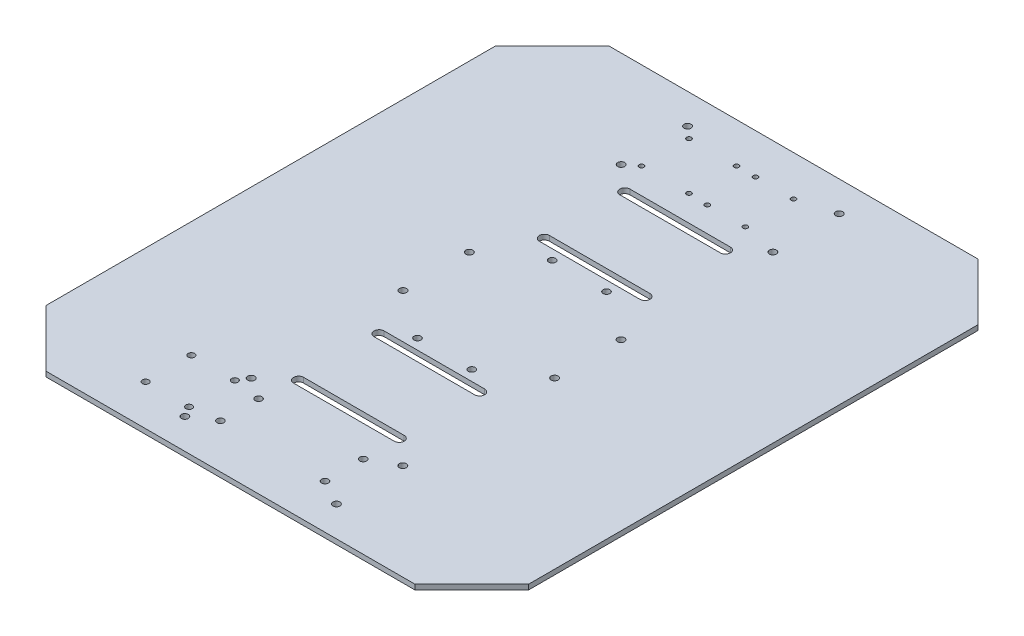
from build123d import *

# Parameters (mm, degrees)
SKETCH1_R               = 2.2225
BOSS_EXTRUDE1_DEPTH     = 3.175
SKETCH2_R               = 2.159
CUT_EXTRUDE1_DEPTH      = 297.247830215
CUT_EXTRUDE2_DEPTH      = 297.247830215
SKETCH7_R               = 1.524
CUT_EXTRUDE3_DEPTH      = 297.247830215
CUT_EXTRUDE4_DEPTH      = 297.247830215
CUT_EXTRUDE4_DEPTH_BACK = 297.247830215
SKETCH8_R               = 1.524
SKETCH9_R               = 2.032
CUT_EXTRUDE5_DEPTH      = 297.247830215
SKETCH10_R              = 2.159
CUT_EXTRUDE6_DEPTH      = 297.247830215


with BuildPart() as part:
    # Sketch1 → Boss-Extrude1 (new body)
    with BuildSketch(Plane(origin=(0, 0, 0), x_dir=(1, 0, 0), z_dir=(0, 1, 0))):
        Polygon((-85.365028143, 123.058976948), (-121.286052627, 87.137952464), (-121.286052627, -196.619998567), (-85.365028143, -232.541023052), (147.592922888, -232.541023052), (183.513947373, -196.619998567), (183.513947373, 87.137952464), (147.592922888, 123.058976948), align=None)
        with Locations((-16.765052627, -213.491023052)):
            Circle(SKETCH1_R, mode=Mode.SUBTRACT)
        with Locations((-16.765052627, -171.581023052)):
            Circle(SKETCH1_R, mode=Mode.SUBTRACT)
        with Locations((-16.765052627, -75.696023052)):
            Circle(SKETCH1_R, mode=Mode.SUBTRACT)
        with Locations((78.992947373, -213.491023052)):
            Circle(SKETCH1_R, mode=Mode.SUBTRACT)
        with Locations((78.992947373, -171.581023052)):
            Circle(SKETCH1_R, mode=Mode.SUBTRACT)
        with Locations((78.992947373, -75.696023052)):
            Circle(SKETCH1_R, mode=Mode.SUBTRACT)
        with Locations((-16.765052627, -33.786023052)):
            Circle(SKETCH1_R, mode=Mode.SUBTRACT)
        with Locations((-16.765052627, 62.098976948)):
            Circle(SKETCH1_R, mode=Mode.SUBTRACT)
        with Locations((-16.765052627, 104.008976948)):
            Circle(SKETCH1_R, mode=Mode.SUBTRACT)
        with Locations((78.992947373, -33.786023052)):
            Circle(SKETCH1_R, mode=Mode.SUBTRACT)
        with Locations((78.992947373, 62.098976948)):
            Circle(SKETCH1_R, mode=Mode.SUBTRACT)
        with Locations((78.992947373, 104.008976948)):
            Circle(SKETCH1_R, mode=Mode.SUBTRACT)
    extrude(amount=BOSS_EXTRUDE1_DEPTH)

    # Sketch2 → Cut-Extrude1 (cut, through all)
    with BuildSketch(Plane(origin=(0, 3.175, 0), x_dir=(1, 0, 0), z_dir=(0, 1, 0))):
        with Locations((13.841947373, -12.069023052)):
            Circle(SKETCH2_R)
        with Locations((48.131947373, -12.069023052)):
            Circle(SKETCH2_R)
        with Locations((13.841947373, -97.159023052)):
            Circle(SKETCH2_R)
        with Locations((48.131947373, -97.159023052)):
            Circle(SKETCH2_R)
    extrude(amount=-CUT_EXTRUDE1_DEPTH, mode=Mode.SUBTRACT)

    # Sketch4 → Cut-Extrude2 (cut, through all)
    with BuildSketch(Plane(origin=(0, 3.175, 0), x_dir=(1, 0, 0), z_dir=(0, 1, 0))):
        with BuildLine():
            Line((-0.636052627, 51.430976948), (62.863947373, 51.430976948))
            ThreePointArc((62.863947373, 51.430976948), (66.038947373, 48.255976948), (62.863947373, 45.080976948))
            Line((62.863947373, 45.080976948), (-0.636052627, 45.080976948))
            ThreePointArc((-0.636052627, 45.080976948), (-3.811052627, 48.255976948), (-0.636052627, 51.430976948))
        make_face()
        with BuildLine():
            Line((-0.636052627, 0.630976948), (62.863947373, 0.630976948))
            ThreePointArc((62.863947373, 0.630976948), (66.038947373, -2.544023052), (62.863947373, -5.719023052))
            Line((62.863947373, -5.719023052), (-0.636052627, -5.719023052))
            ThreePointArc((-0.636052627, -5.719023052), (-3.811052627, -2.544023052), (-0.636052627, 0.630976948))
        make_face()
        with BuildLine():
            Line((-0.636052627, -110.113023052), (62.863947373, -110.113023052))
            ThreePointArc((62.863947373, -110.113023052), (66.038947373, -106.938023052), (62.863947373, -103.763023052))
            Line((62.863947373, -103.763023052), (-0.636052627, -103.763023052))
            ThreePointArc((-0.636052627, -103.763023052), (-3.811052627, -106.938023052), (-0.636052627, -110.113023052))
        make_face()
        with BuildLine():
            Line((-0.636052627, -160.913023052), (62.863947373, -160.913023052))
            ThreePointArc((62.863947373, -160.913023052), (66.038947373, -157.738023052), (62.863947373, -154.563023052))
            Line((62.863947373, -154.563023052), (-0.636052627, -154.563023052))
            ThreePointArc((-0.636052627, -154.563023052), (-3.811052627, -157.738023052), (-0.636052627, -160.913023052))
        make_face()
    extrude(amount=-CUT_EXTRUDE2_DEPTH, mode=Mode.SUBTRACT)

    # Sketch7 → Cut-Extrude3 (cut, through all)
    with BuildSketch(Plane(origin=(0, 3.175, 0), x_dir=(1, 0, 0), z_dir=(0, 1, 0))):
        with Locations((-9.526052627, 67.686976948)):
            Circle(SKETCH7_R)
        with Locations((20.445947373, 67.686976948)):
            Circle(SKETCH7_R)
        with Locations((-9.526052627, 97.658976948)):
            Circle(SKETCH7_R)
        with Locations((20.445947373, 97.658976948)):
            Circle(SKETCH7_R)
    extrude(amount=-CUT_EXTRUDE3_DEPTH, mode=Mode.SUBTRACT)

    # Sketch8 → Cut-Extrude4 (cut, two sides: drawn at the far end of the back side and taken through both)
    with BuildSketch(Plane(origin=(0, 3.175, 0), x_dir=(1, 0, 0), z_dir=(0, 1, 0)).offset(-CUT_EXTRUDE4_DEPTH_BACK)):
        with Locations((32.513487373, 67.178976948)):
            Circle(SKETCH8_R)
        with Locations((32.513487373, 97.658976948)):
            Circle(SKETCH8_R)
        with Locations((56.513947373, 67.178976948)):
            Circle(SKETCH8_R)
        with Locations((56.513947373, 97.658976948)):
            Circle(SKETCH8_R)
    extrude(amount=CUT_EXTRUDE4_DEPTH + CUT_EXTRUDE4_DEPTH_BACK, mode=Mode.SUBTRACT)

    # Sketch9 → Cut-Extrude5 (cut, through all)
    with BuildSketch(Plane(origin=(0, 0, 0), x_dir=(-1, 0, 0), z_dir=(0, -1, 0))):
        with Locations((48.134052627, -206.887023052)):
            Circle(SKETCH9_R)
        with Locations((20.702052627, -206.887023052)):
            Circle(SKETCH9_R)
        with Locations((48.134052627, -177.931023052)):
            Circle(SKETCH9_R)
        with Locations((20.702052627, -177.931023052)):
            Circle(SKETCH9_R)
    extrude(amount=-CUT_EXTRUDE5_DEPTH, mode=Mode.SUBTRACT)

    # Sketch10 → Cut-Extrude6 (cut, through all)
    with BuildSketch(Plane.XZ):
        with Locations((-3.176052627, 204.601023052)):
            Circle(SKETCH10_R)
        with Locations((62.863947373, 204.601023052)):
            Circle(SKETCH10_R)
        with Locations((-3.176052627, 180.471023052)):
            Circle(SKETCH10_R)
        with Locations((62.863947373, 180.471023052)):
            Circle(SKETCH10_R)
    extrude(amount=-CUT_EXTRUDE6_DEPTH, mode=Mode.SUBTRACT)


solid = part.part
